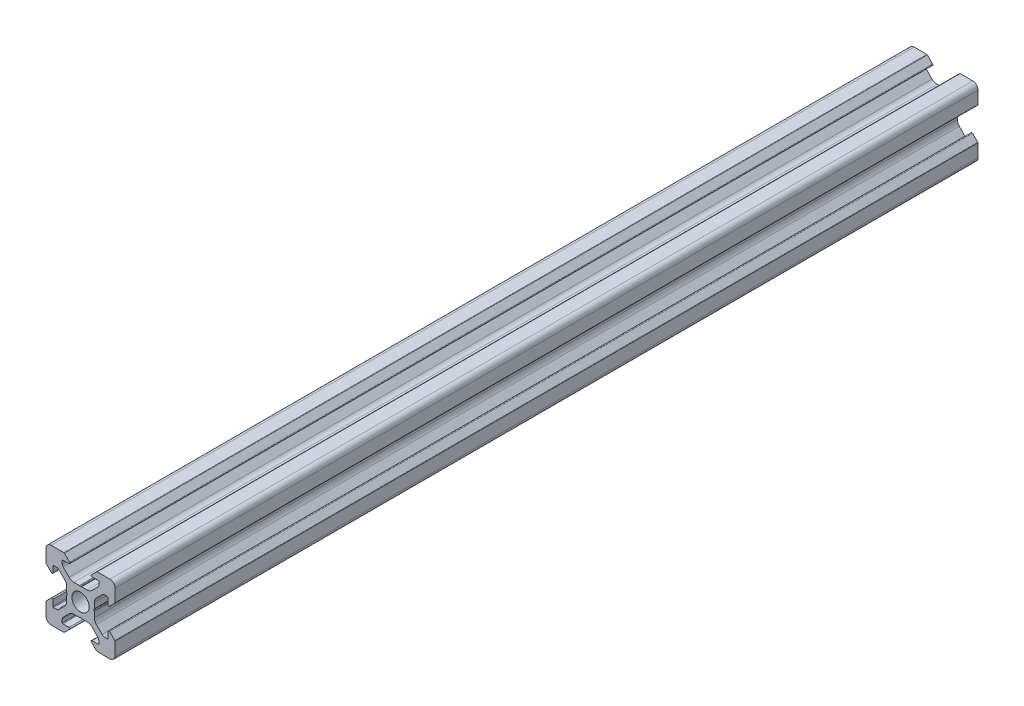
from build123d import *

# Parameters (mm, degrees)
SKETCH_181_R      = 2.5
EXTRUDE_724_DEPTH = 250


with BuildPart() as part:
    # Sketch 181 → Extrude 724 (new body)
    with BuildSketch(Plane.XY):
        with BuildLine():
            Line((-4, 1.898780669), (-4, 0.337695265))
            ThreePointArc((-4, 0.337695265), (-3.98590708, 0.254943529), (-3.945217202, 0.181521503))
            Line((-3.945217202, 0.181521503), (-3.8, 0))
            Line((-3.8, 0), (-3.945217202, -0.181521503))
            ThreePointArc((-3.945217202, -0.181521503), (-3.98590708, -0.254943529), (-4, -0.337695265))
            Line((-4, -0.337695265), (-4, -1.898780669))
            ThreePointArc((-4, -1.898780669), (-4.152240935, -2.664147534), (-4.585786438, -3.312994231))
            Line((-4.585786438, -3.312994231), (-6.279898987, -5.007106781))
            ThreePointArc((-6.279898987, -5.007106781), (-6.604322336, -5.223879533), (-6.987005769, -5.3))
            Line((-6.987005769, -5.3), (-7.8, -5.3))
            ThreePointArc((-7.8, -5.3), (-7.941421356, -5.241421356), (-8, -5.1))
            Line((-8, -5.1), (-8, -3.33))
            ThreePointArc((-8, -3.33), (-8.154329142, -3.099030117), (-8.426776695, -3.153223305))
            Line((-8.426776695, -3.153223305), (-9.926776695, -4.653223305))
            ThreePointArc((-9.926776695, -4.653223305), (-9.980969883, -4.734329142), (-10, -4.83))
            Line((-10, -4.83), (-10, -8.5))
            ThreePointArc((-10, -8.5), (-9.560660172, -9.560660172), (-8.5, -10))
            Line((-8.5, -10), (-4.83, -10))
            ThreePointArc((-4.83, -10), (-4.734329142, -9.980969883), (-4.653223305, -9.926776695))
            Line((-4.653223305, -9.926776695), (-3.153223305, -8.426776695))
            ThreePointArc((-3.153223305, -8.426776695), (-3.099030117, -8.154329142), (-3.33, -8))
            Line((-3.33, -8), (-5.1, -8))
            ThreePointArc((-5.1, -8), (-5.241421356, -7.941421356), (-5.3, -7.8))
            Line((-5.3, -7.8), (-5.3, -6.987005769))
            ThreePointArc((-5.3, -6.987005769), (-5.223879533, -6.604322336), (-5.007106781, -6.279898987))
            Line((-5.007106781, -6.279898987), (-3.312994231, -4.585786438))
            ThreePointArc((-3.312994231, -4.585786438), (-2.664147534, -4.152240935), (-1.898780669, -4))
            Line((-1.898780669, -4), (-0.337695265, -4))
            ThreePointArc((-0.337695265, -4), (-0.254943529, -3.98590708), (-0.181521503, -3.945217202))
            Line((-0.181521503, -3.945217202), (0, -3.8))
            Line((0, -3.8), (0.181521503, -3.945217202))
            ThreePointArc((0.181521503, -3.945217202), (0.254943529, -3.98590708), (0.337695265, -4))
            Line((0.337695265, -4), (1.898780669, -4))
            ThreePointArc((1.898780669, -4), (2.664147534, -4.152240935), (3.312994231, -4.585786438))
            Line((3.312994231, -4.585786438), (5.007106781, -6.279898987))
            ThreePointArc((5.007106781, -6.279898987), (5.223879533, -6.604322336), (5.3, -6.987005769))
            Line((5.3, -6.987005769), (5.3, -7.8))
            ThreePointArc((5.3, -7.8), (5.241421356, -7.941421356), (5.1, -8))
            Line((5.1, -8), (3.33, -8))
            ThreePointArc((3.33, -8), (3.099030117, -8.154329142), (3.153223305, -8.426776695))
            Line((3.153223305, -8.426776695), (4.653223305, -9.926776695))
            ThreePointArc((4.653223305, -9.926776695), (4.734329142, -9.980969883), (4.83, -10))
            Line((4.83, -10), (8.5, -10))
            ThreePointArc((8.5, -10), (9.560660172, -9.560660172), (10, -8.5))
            Line((10, -8.5), (10, -4.83))
            ThreePointArc((10, -4.83), (9.980969883, -4.734329142), (9.926776695, -4.653223305))
            Line((9.926776695, -4.653223305), (8.426776695, -3.153223305))
            ThreePointArc((8.426776695, -3.153223305), (8.154329142, -3.099030117), (8, -3.33))
            Line((8, -3.33), (8, -5.1))
            ThreePointArc((8, -5.1), (7.941421356, -5.241421356), (7.8, -5.3))
            Line((7.8, -5.3), (6.987005769, -5.3))
            ThreePointArc((6.987005769, -5.3), (6.604322336, -5.223879533), (6.279898987, -5.007106781))
            Line((6.279898987, -5.007106781), (4.585786438, -3.312994231))
            ThreePointArc((4.585786438, -3.312994231), (4.152240935, -2.664147534), (4, -1.898780669))
            Line((4, -1.898780669), (4, -0.337695265))
            ThreePointArc((4, -0.337695265), (3.98590708, -0.254943529), (3.945217202, -0.181521503))
            Line((3.945217202, -0.181521503), (3.8, 0))
            Line((3.8, 0), (3.945217202, 0.181521503))
            ThreePointArc((3.945217202, 0.181521503), (3.98590708, 0.254943529), (4, 0.337695265))
            Line((4, 0.337695265), (4, 1.898780669))
            ThreePointArc((4, 1.898780669), (4.152240935, 2.664147534), (4.585786438, 3.312994231))
            Line((4.585786438, 3.312994231), (6.279898987, 5.007106781))
            ThreePointArc((6.279898987, 5.007106781), (6.604322336, 5.223879533), (6.987005769, 5.3))
            Line((6.987005769, 5.3), (7.8, 5.3))
            ThreePointArc((7.8, 5.3), (7.941421356, 5.241421356), (8, 5.1))
            Line((8, 5.1), (8, 3.33))
            ThreePointArc((8, 3.33), (8.154329142, 3.099030117), (8.426776695, 3.153223305))
            Line((8.426776695, 3.153223305), (9.926776695, 4.653223305))
            ThreePointArc((9.926776695, 4.653223305), (9.980969883, 4.734329142), (10, 4.83))
            Line((10, 4.83), (10, 8.5))
            ThreePointArc((10, 8.5), (9.560660172, 9.560660172), (8.5, 10))
            Line((8.5, 10), (4.83, 10))
            ThreePointArc((4.83, 10), (4.734329142, 9.980969883), (4.653223305, 9.926776695))
            Line((4.653223305, 9.926776695), (3.153223305, 8.426776695))
            ThreePointArc((3.153223305, 8.426776695), (3.099030117, 8.154329142), (3.33, 8))
            Line((3.33, 8), (5.1, 8))
            ThreePointArc((5.1, 8), (5.241421356, 7.941421356), (5.3, 7.8))
            Line((5.3, 7.8), (5.3, 6.987005769))
            ThreePointArc((5.3, 6.987005769), (5.223879533, 6.604322336), (5.007106781, 6.279898987))
            Line((5.007106781, 6.279898987), (3.312994231, 4.585786438))
            ThreePointArc((3.312994231, 4.585786438), (2.664147534, 4.152240935), (1.898780669, 4))
            Line((1.898780669, 4), (0.337695265, 4))
            ThreePointArc((0.337695265, 4), (0.254943529, 3.98590708), (0.181521503, 3.945217202))
            Line((0.181521503, 3.945217202), (0, 3.8))
            Line((0, 3.8), (-0.181521503, 3.945217202))
            ThreePointArc((-0.181521503, 3.945217202), (-0.254943529, 3.98590708), (-0.337695265, 4))
            Line((-0.337695265, 4), (-1.898780669, 4))
            ThreePointArc((-1.898780669, 4), (-2.664147534, 4.152240935), (-3.312994231, 4.585786438))
            Line((-3.312994231, 4.585786438), (-5.007106781, 6.279898987))
            ThreePointArc((-5.007106781, 6.279898987), (-5.223879533, 6.604322336), (-5.3, 6.987005769))
            Line((-5.3, 6.987005769), (-5.3, 7.8))
            ThreePointArc((-5.3, 7.8), (-5.241421356, 7.941421356), (-5.1, 8))
            Line((-5.1, 8), (-3.33, 8))
            ThreePointArc((-3.33, 8), (-3.099030117, 8.154329142), (-3.153223305, 8.426776695))
            Line((-3.153223305, 8.426776695), (-4.653223305, 9.926776695))
            ThreePointArc((-4.653223305, 9.926776695), (-4.734329142, 9.980969883), (-4.83, 10))
            Line((-4.83, 10), (-8.5, 10))
            ThreePointArc((-8.5, 10), (-9.560660172, 9.560660172), (-10, 8.5))
            Line((-10, 8.5), (-10, 4.83))
            ThreePointArc((-10, 4.83), (-9.980969883, 4.734329142), (-9.926776695, 4.653223305))
            Line((-9.926776695, 4.653223305), (-8.426776695, 3.153223305))
            ThreePointArc((-8.426776695, 3.153223305), (-8.154329142, 3.099030117), (-8, 3.33))
            Line((-8, 3.33), (-8, 5.1))
            ThreePointArc((-8, 5.1), (-7.941421356, 5.241421356), (-7.8, 5.3))
            Line((-7.8, 5.3), (-6.987005769, 5.3))
            ThreePointArc((-6.987005769, 5.3), (-6.604322336, 5.223879533), (-6.279898987, 5.007106781))
            Line((-6.279898987, 5.007106781), (-4.585786438, 3.312994231))
            ThreePointArc((-4.585786438, 3.312994231), (-4.152240935, 2.664147534), (-4, 1.898780669))
        make_face()
        Circle(SKETCH_181_R, mode=Mode.SUBTRACT)
    extrude(amount=-EXTRUDE_724_DEPTH)


solid = part.part
